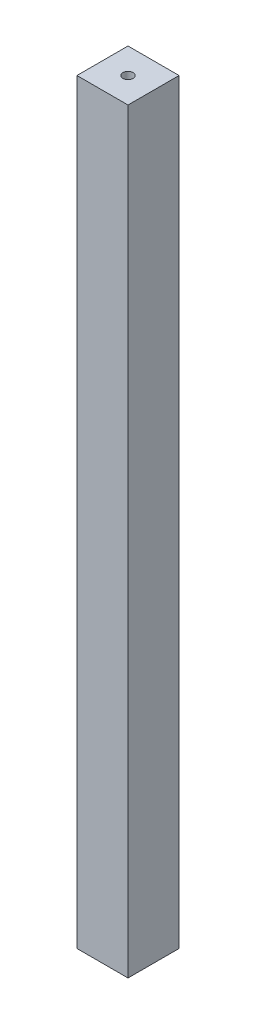
from build123d import *

# Parameters (mm, degrees)
SKETCH1_W           = 15
SKETCH1_H           = 15
SKETCH1_R           = 1.5
BOSS_EXTRUDE1_DEPTH = 222


with BuildPart() as part:
    # Sketch1 → Boss-Extrude1 (new body)
    with BuildSketch(Plane(origin=(0, 0, 0), x_dir=(1, 0, 0), z_dir=(0, 1, 0))):
        Rectangle(SKETCH1_W, SKETCH1_H)
        Circle(SKETCH1_R, mode=Mode.SUBTRACT)
    extrude(amount=BOSS_EXTRUDE1_DEPTH)


solid = part.part
